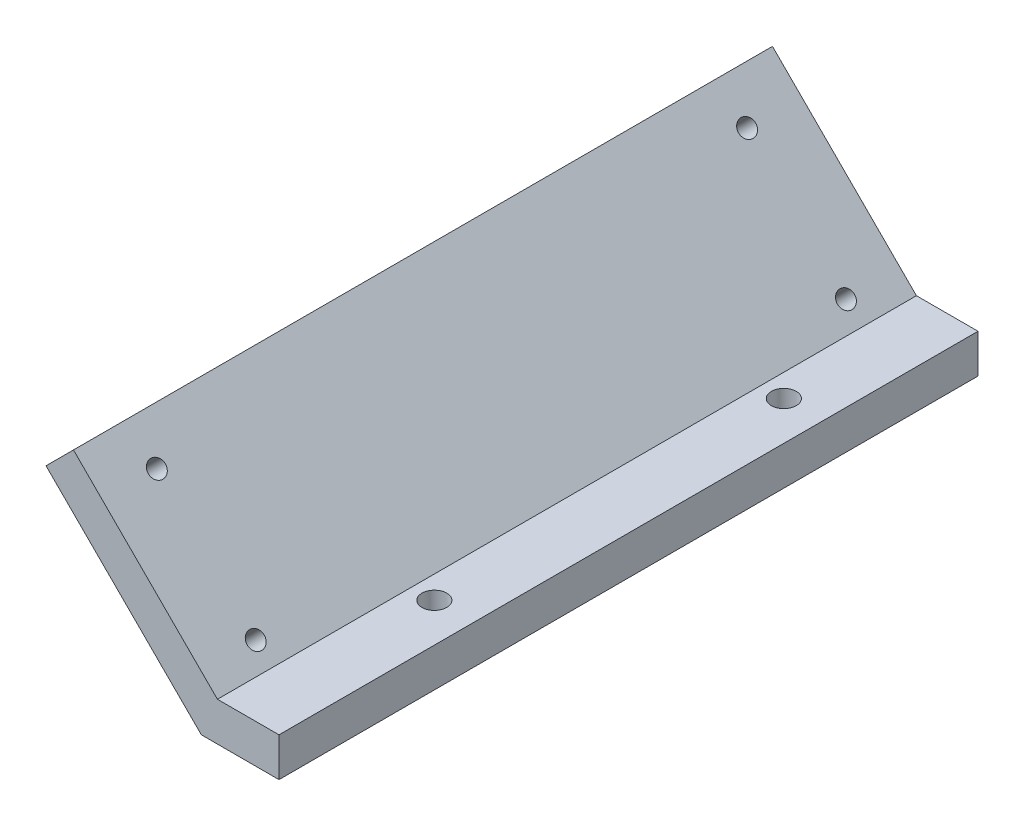
from build123d import *

# Parameters (mm, degrees)
EXTRUDE_1_DEPTH     = 90
SKETCH_2_R          = 1.6
CUT_EXTRUDE_1_DEPTH = 10
SKETCH_3_R          = 1.1
CUT_EXTRUDE_2_DEPTH = 10


with BuildPart() as part:
    # 草图1 → 凸台-拉伸1 (new body)
    with BuildSketch(Plane.XY):
        Polygon((0, 0), (-20, 20), (-16.464466094, 23.535533906), (2.071067812, 5), (10, 5), (10, 0), align=None)
    extrude(amount=EXTRUDE_1_DEPTH)

    # 草图2 → 切除-拉伸1 (cut)
    with BuildSketch(Plane(origin=(0, 5, 0), x_dir=(1, 0, 0), z_dir=(0, 1, 0))):
        with Locations((5, -20)):
            Circle(SKETCH_2_R)
        with Locations((5, -65)):
            Circle(SKETCH_2_R)
    extrude(amount=-CUT_EXTRUDE_1_DEPTH, mode=Mode.SUBTRACT)

    # 草图3 → 切除-拉伸2 (cut)
    with BuildSketch(Plane(origin=(0, 0, 0), x_dir=(0, 0, 1), z_dir=(-0.7071067811865477, -0.7071067811865475, 0))):
        with Locations((7, 23)):
            Circle(SKETCH_3_R)
        with Locations((83, 23)):
            Circle(SKETCH_3_R)
        with Locations((83, 5)):
            Circle(SKETCH_3_R)
        with Locations((7, 5)):
            Circle(SKETCH_3_R)
    extrude(amount=-CUT_EXTRUDE_2_DEPTH, mode=Mode.SUBTRACT)


solid = part.part
